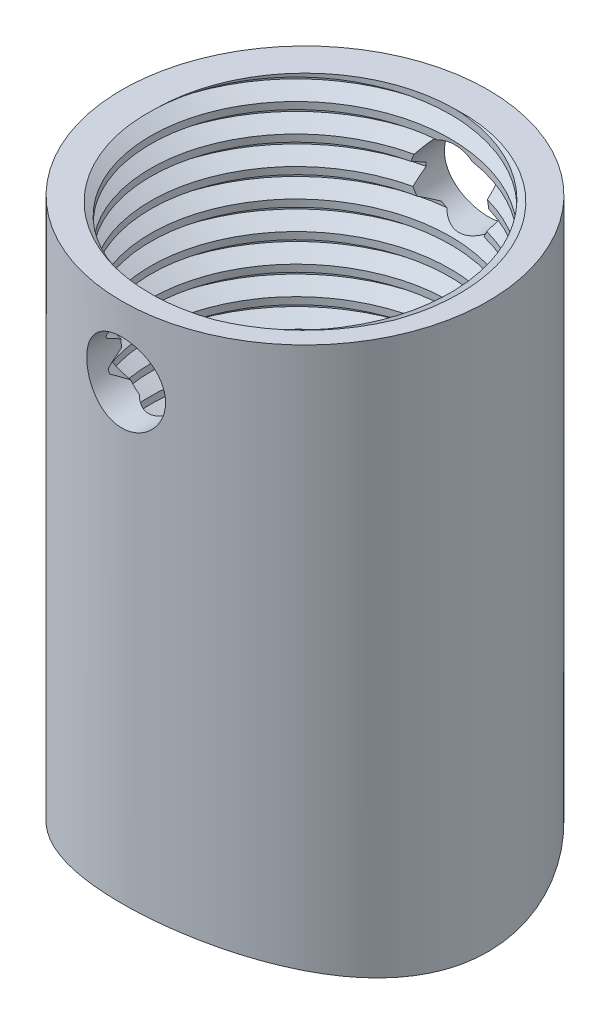
from build123d import *

# Parameters (mm, degrees)
SKETCH1_R               = 16.51
SKETCH1_R_2             = 13.335
BOSS_EXTRUDE1_DEPTH     = 50.8
SKETCH2_R               = 13.335
BOSS_EXTRUDE2_DEPTH     = 12.7
CUT_EXTRUDE2_DEPTH      = 56.908856186
CUT_EXTRUDE2_DEPTH_BACK = 56.908856186
MOVE_FACE1_BY           = 0.1778
THREAD1_PITCH           = 2.54
CUT_EXTRUDE3_DEPTH      = 56.908856336
CUT_EXTRUDE3_DEPTH_BACK = 56.908856336
SKETCH4_R               = 3.556


with BuildPart() as part:
    # Sketch1 → Boss-Extrude1 (new body)
    with BuildSketch(Plane(origin=(0, 0, 0), x_dir=(1, 0, 0), z_dir=(0, 1, 0))):
        with Locations(Location((0, 0, 0), (0, 0, 270))):
            Circle(SKETCH1_R)
        with Locations(Location((0, 0, 0), (0, 0, 270))):
            Circle(SKETCH1_R_2, mode=Mode.SUBTRACT)
    extrude(amount=BOSS_EXTRUDE1_DEPTH)

    # Sketch2 → Boss-Extrude2 (add)
    with BuildSketch(Plane(origin=(0, 0, 0), x_dir=(1, 0, 0), z_dir=(0, 1, 0))):
        with Locations(Location((0, 0, 0), (0, 0, 270))):
            Circle(SKETCH2_R)
    extrude(amount=BOSS_EXTRUDE2_DEPTH)

    # Sketch3 → Cut-Extrude2 (cut, two sides: drawn at the far end of the back side and taken through both)
    with BuildSketch(Plane.XY.offset(-CUT_EXTRUDE2_DEPTH_BACK)):
        with BuildLine():
            Line((-16.51, 0), (16.51, 0))
            ThreePointArc((16.51, 0), (0, 3.76299518), (-16.51, 0))
        make_face()
    extrude(amount=CUT_EXTRUDE2_DEPTH + CUT_EXTRUDE2_DEPTH_BACK, mode=Mode.SUBTRACT)

    # Move Face1: a curved face moved inward by 0.1778
    add(Solid.thicken(part.faces().sort_by_distance((0, 31.75, -13.335))[0], -MOVE_FACE1_BY), mode=Mode.SUBTRACT)

    # Thread1: the profile of Thread Profile1 profile screwed along a right-hand helix of 16 turns, 10 arcs to a turn; built about Z, then put on its axis
    thread1_z = Axis((0, 0, 0), (0, 0, 1))
    thread1_corners = [(13.5125, 0, -0.000173205), (14.887615323, 0, 0.793749997), (14.887615323, 0, 1.111249997), (13.5125, 0, 1.905173198)]
    with BuildLine(mode=Mode.PRIVATE) as thread1_profile:
        Line(thread1_corners[0], thread1_corners[1])
        Line(thread1_corners[1], thread1_corners[2])
        Line(thread1_corners[2], thread1_corners[3])
        Line(thread1_corners[3], thread1_corners[0])
    thread1_cap = Face(thread1_profile.wire())
    thread1_turn_angles = [0, 18, 36, 54, 72, 90, 108, 126, 144, 162, 180, 198, 216, 234, 252, 270, 288, 306, 324, 342, 360]
    thread1_turn_weights = [1, 0.9510565162951535, 1, 0.9510565162951535, 1, 0.9510565162951535, 1, 0.9510565162951535, 1, 0.9510565162951535, 1, 0.9510565162951535, 1, 0.9510565162951535, 1, 0.9510565162951535, 1, 0.9510565162951535, 1, 0.9510565162951535, 1]
    thread1_turn_rails = [Edge.make_bspline([Vector(p[0], p[1], 0).rotate(thread1_z, thread1_turn_angles[k]) / thread1_turn_weights[k] + Vector(0, 0, p[2] + THREAD1_PITCH * thread1_turn_angles[k] / 360) for k in range(21)], [0, 0, 0, 1, 1, 2, 2, 3, 3, 4, 4, 5, 5, 6, 6, 7, 7, 8, 8, 9, 9, 10, 10, 10], 2, thread1_turn_weights) for p in thread1_corners]
    thread1_turn_sides = [Face.make_surface_from_curves(thread1_turn_rails[p[0]], thread1_turn_rails[p[1]]) for p in [(0, 1), (1, 2), (2, 3), (3, 0)]]
    thread1 = Plane(origin=(0, 53.34, 0), x_dir=(-1, 0, 0), z_dir=(0, -1, 0)) * Solid(Shell([*[p.moved(Location((0, 0, THREAD1_PITCH * i))) for i in range(16) for p in thread1_turn_sides], thread1_cap, thread1_cap.rotate(thread1_z, 5760).moved(Location((0, 0, THREAD1_PITCH * 5760 / 360)))]))
    add(thread1, mode=Mode.SUBTRACT)

    # Sketch4 → Cut-Extrude3 (cut, two sides: drawn at the far end of the back side and taken through both)
    with BuildSketch(Plane.XY.offset(-CUT_EXTRUDE3_DEPTH_BACK)):
        with Locations((0, 44.45)):
            Circle(SKETCH4_R)
    extrude(amount=CUT_EXTRUDE3_DEPTH + CUT_EXTRUDE3_DEPTH_BACK, mode=Mode.SUBTRACT)


solid = part.part
